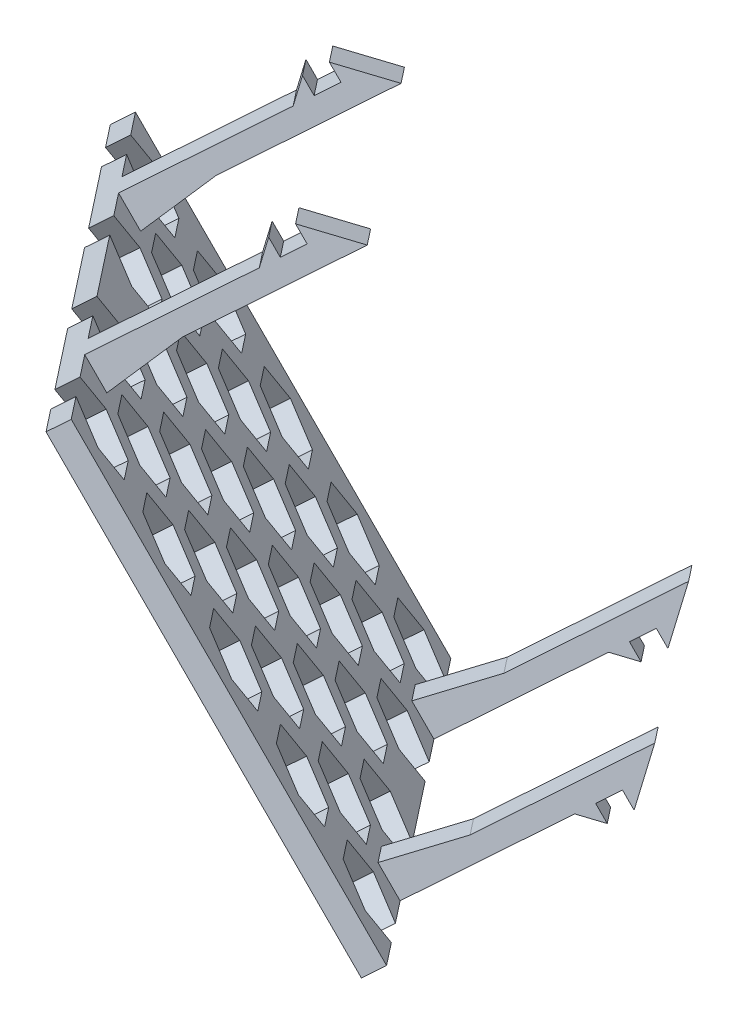
from build123d import *

# Parameters (mm, degrees)
EXTRUDE_1_DEPTH             = 3
EXTRUDE_2_DEPTH             = 5
CHAMFER_1_SIZE              = 10
CHAMFER_1_SIZE2             = 1.7632698070846542
CHAMFER_1_OF_MIRROR_1_SIZE2 = 1.7632698070846542
CHAMFER_1_OF_MIRROR_1_SIZE  = 10
MIRROR_START                = 100.557274191
MIRROR_2_DEPTH              = 5
MIRROR_START_2              = 150.557274191
MIRROR_2_2_DEPTH            = 5
CUT_EXTRUDE_START           = -3
CUT_EXTRUDE_1_DEPTH         = 3
EXTRUDE_3_DEPTH             = 5
MIRROR_4_COPY_1_DEPTH       = 5


# Read off the part's stored shape, not the designer's step: 镜向2, 切除-拉伸1
with BuildPart() as part:
    # 草图1 → 凸台-拉伸1 (new body)
    with BuildSketch(Plane(origin=(-302.9852871236554, -539.4308733926825, 499.4175609106197), x_dir=(0.823284870968576, -0.3326085977835135, 0.459971240312631), z_dir=(-0.5676284182757724, -0.4824135256318378, 0.6671395424146325))):
        Polygon((-177.69119627834579, 290.92528000789076), (-105.02181846396432, 352.1148340843072), (-61.22297975663468, 300.09885838559205), (-133.89235757101616, 238.90930430917564), align=None)
    extrude(amount=EXTRUDE_1_DEPTH)

    # 草图2 → 凸台-拉伸2 (add)
    with BuildSketch(Plane(origin=(66.47619270977926, 28.238015488062796, 76.97966237080274), x_dir=(-0.7767863592562881, 0.2168814389007045, 0.5912405547099429), z_dir=(-0.6297642035503137, -0.2675136858592245, -0.7292691381133932))):
        Polygon((645.8799483555844, -434.2199494311762), (624.3231352890325, -414.0815828039215), (626.0297765286305, -412.25473423895954), (618.2560989585985, -412.5191903547605), (643.8319788680668, -436.4121677091307), align=None)
    extrude_2 = extrude(amount=EXTRUDE_2_DEPTH)

    # 倒角1
    chamfer_1_edges = [part.edges().sort_by_distance(p)[0] for p in [
        (-433.51523138196615, -241.06448364626053, 604.1085165056885),
    ]]
    chamfer_1_side = [part.faces().sort_by_distance(p)[0] for p in [
        (-424.4331766895539, -233.34586723615118, 593.4342838270544),
    ]]
    chamfer(chamfer_1_edges, length=CHAMFER_1_SIZE, length2=CHAMFER_1_SIZE2, reference=chamfer_1_side[0])

    # 镜向1: 凸台-拉伸2 across plane
    add(extrude_2.mirror(Plane(origin=(80.64588728966129, 34.25707341989526, 93.388217978354), x_dir=(-0.6712211429872029, -0.2851239257088115, 0.6842269537188292), z_dir=(0.6297642035503136, 0.26751368585922486, 0.729269138113393))))

    # 倒角1 of 镜向1
    chamfer_1_of_mirror_1_edges = [part.edges().sort_by_distance(p)[0] for p in [
        (-402.0270212044504, -227.68879935329932, 640.571973411358),
    ]]
    chamfer(chamfer_1_of_mirror_1_edges, length=CHAMFER_1_OF_MIRROR_1_SIZE, length2=CHAMFER_1_OF_MIRROR_1_SIZE2)

    # 镜向2 outline → 镜向2 (add)
    with BuildSketch(Plane(origin=(0, 0, 0), x_dir=(0.7767863592562967, -0.21688143890071088, -0.5912405547099291), z_dir=(0.6297642035503029, 0.26751368585923996, 0.7292691381133969)).offset(MIRROR_START)):
        Polygon((-597.267088361, -481.862260911), (-577.902493572, -463.771863771), (-576.195852332, -465.598712336), (-575.931396217, -457.825034766), (-592.007663588, -472.843477674), (-600.518765436, -478.381551866), align=None)
    extrude(amount=MIRROR_2_DEPTH)

    # Mirror 2 2 outline → Mirror 2 2 (add)
    with BuildSketch(Plane(origin=(0, 0, 0), x_dir=(0.7767863592562967, -0.21688143890071088, -0.5912405547099291), z_dir=(0.6297642035503029, 0.26751368585923996, 0.7292691381133969)).offset(MIRROR_START_2)):
        Polygon((-597.267088361, -481.862260911), (-577.902493572, -463.771863771), (-576.195852332, -465.598712336), (-575.931396217, -457.825034766), (-592.007663588, -472.843477674), (-600.518765436, -478.381551866), align=None)
    extrude(amount=MIRROR_2_2_DEPTH)

    # 切除-拉伸1 outline → 切除-拉伸1 (cut)
    with BuildSketch(Plane(origin=(-436.1617099127484, -370.683181902277, 512.6253622992621), x_dir=(0.8232848709685762, -0.3326085977835133, 0.45997124031263076), z_dir=(-0.5676284182757722, -0.48241352563183804, 0.6671395424146325)).offset(CUT_EXTRUDE_START)):
        Polygon((-11.539182151, 145.08829532), (-5.897514961, 143.045847938), (-1.307870046, 146.910451353), (-2.359892322, 152.817502151), (-8.001559513, 154.859949534), (-12.591204427, 150.995346118), align=None)
        Polygon((49.265906307, 203.080682971), (44.676261393, 199.216079555), (45.728283669, 193.309028757), (51.369950859, 191.266581375), (55.959595774, 195.13118479), (54.907573498, 201.038235588), align=None)
        Polygon((30.176751034, 187.007105158), (25.587106119, 183.142501743), (26.639128395, 177.235450945), (32.280795586, 175.193003562), (36.870440501, 179.057606978), (35.818418225, 184.964657776), align=None)
        Polygon((11.087595761, 170.933527346), (6.497950846, 167.068923931), (7.549973122, 161.161873133), (13.191640313, 159.11942575), (17.781285227, 162.984029165), (16.729262951, 168.891079963), align=None)
        Polygon((82.735446524, 167.982016712), (77.093779334, 170.024464094), (72.504134419, 166.159860679), (73.556156695, 160.252809881), (79.197823885, 158.210362498), (83.7874688, 162.074965914), align=None)
        Polygon((19.833738654, 121.809982824), (15.244093739, 117.945379408), (16.296116015, 112.03832861), (21.937783206, 109.995881227), (26.52742812, 113.860484643), (25.475405844, 119.767535441), align=None)
        Polygon((63.647776992, 151.914209588), (58.006109802, 153.956656971), (53.416464887, 150.092053555), (54.468487163, 144.185002757), (60.110154354, 142.142555374), (64.699799268, 146.00715879), align=None)
        Polygon((38.916954529, 137.883079158), (34.327309614, 134.018475743), (35.37933189, 128.111424945), (41.020999081, 126.068977562), (45.610643995, 129.933580978), (44.558621719, 135.840631776), align=None)
        Polygon((31.428171122, 127.404806736), (30.376148846, 133.311857535), (24.734481655, 135.354304917), (20.144836741, 131.489701502), (21.196859017, 125.582650704), (26.838526207, 123.540203321), align=None)
        Polygon((45.927681481, 139.613781133), (50.517326395, 143.478384549), (49.465304119, 149.385435347), (43.823636929, 151.42788273), (39.233992014, 147.563279314), (40.28601429, 141.656228516), align=None)
        Polygon((59.375169563, 157.729806328), (65.016836754, 155.687358946), (69.606481669, 159.551962361), (68.554459393, 165.459013159), (62.912792202, 167.501460542), (58.323147288, 163.636857126), align=None)
        Polygon((63.222393818, 177.177416296), (64.274416094, 171.270365498), (69.916083285, 169.227918116), (74.505728199, 173.092521531), (73.453705924, 178.999572329), (67.812038733, 181.042019712), align=None)
        Polygon((16.199124493, 130.789687892), (10.557457303, 132.832135275), (5.967812388, 128.967531859), (7.019834664, 123.060481061), (12.661501855, 121.018033679), (17.251146769, 124.882637094), align=None)
        Polygon((35.281837572, 146.857841204), (29.640170381, 148.900288587), (25.050525467, 145.035685172), (26.102547743, 139.128634374), (31.744214933, 137.086186991), (36.333859848, 140.950790406), align=None)
        Polygon((48.729325654, 164.973866399), (44.13968074, 161.109262984), (45.191703016, 155.202212186), (50.833370206, 153.159764803), (55.423015121, 157.024368219), (54.370992845, 162.931419017), align=None)
        Polygon((92.012722739, 156.97175807), (86.371055548, 159.014205453), (81.781410634, 155.149602037), (82.83343291, 149.242551239), (88.4751001, 147.200103857), (93.064745015, 151.064707272), align=None)
        Polygon((31.20763428, 98.97937042), (35.797279195, 102.843973835), (34.745256919, 108.751024633), (29.103589728, 110.793472016), (24.513944814, 106.9288686), (25.56596709, 101.021817802), align=None)
        Polygon((50.296789553, 115.052948232), (54.886434468, 118.917551647), (53.834412192, 124.824602445), (48.192745002, 126.867049828), (43.603100087, 123.002446413), (44.655122363, 117.095395615), align=None)
        Polygon((69.385944827, 131.126526044), (73.975589741, 134.99112946), (72.923567465, 140.898180258), (67.281900275, 142.94062764), (62.69225536, 139.076024225), (63.744277636, 133.168973427), align=None)
        Polygon((40.703961595, 116.388777406), (39.651939319, 122.295828204), (34.010272128, 124.338275587), (29.420627214, 120.473672172), (30.47264949, 114.566621374), (36.11431668, 112.524173991), align=None)
        Polygon((55.203471954, 128.597751803), (59.793116868, 132.462355219), (58.741094592, 138.369406017), (53.099427402, 140.411853399), (48.509782487, 136.547249984), (49.561804763, 130.640199186), align=None)
        Polygon((68.650960036, 146.713776998), (74.292627227, 144.671329616), (78.882272142, 148.535933031), (77.830249866, 154.442983829), (72.188582675, 156.485431212), (67.59893776, 152.620827796), align=None)
        Polygon((30.911735824, 171.419854204), (25.270068634, 173.462301587), (20.680423719, 169.597698172), (21.732445995, 163.690647374), (27.374113186, 161.648199991), (31.9637581, 165.512803406), align=None)
        Polygon((11.822580551, 155.346276392), (6.180913361, 157.388723775), (1.591268446, 153.524120359), (2.643290722, 147.617069561), (8.284957912, 145.574622179), (12.874602827, 149.439225594), align=None)
        Polygon((44.359223907, 189.535879399), (39.769578993, 185.671275984), (40.821601269, 179.764225186), (46.463268459, 177.721777803), (51.052913374, 181.586381219), (50.000891098, 187.493432017), align=None)
        Polygon((-2.261905937, 134.078036679), (3.379761254, 132.035589296), (7.969406169, 135.900192711), (6.917383893, 141.807243509), (1.275716702, 143.849690892), (-3.313928212, 139.985087477), align=None)
        Polygon((60.639801934, 180.250070567), (65.229446848, 184.114673982), (64.177424572, 190.02172478), (58.535757382, 192.064172163), (53.946112467, 188.199568748), (54.998134743, 182.29251795), align=None)
        Polygon((16.825763595, 150.145843802), (22.467430786, 148.10339642), (27.0570757, 151.967999835), (26.005053424, 157.875050633), (20.363386234, 159.917498016), (15.773741319, 156.052894601), align=None)
        Polygon((41.556586059, 164.176974232), (46.146230974, 168.041577647), (45.094208698, 173.948628445), (39.452541507, 175.991075828), (34.862896592, 172.126472413), (35.914918868, 166.219421615), align=None)
        Polygon((11.919081195, 136.601040231), (17.560748385, 134.558592849), (22.1503933, 138.423196264), (21.098371024, 144.330247062), (15.456703834, 146.372694445), (10.867058919, 142.508091029), align=None)
        Polygon((55.739058932, 166.705748473), (60.328703847, 170.570351888), (59.276681571, 176.477402687), (53.63501438, 178.519850069), (49.045369466, 174.655246654), (50.097391742, 168.748195856), align=None)
        Polygon((31.008236468, 152.674618044), (36.649903659, 150.632170661), (41.239548573, 154.496774076), (40.187526297, 160.403824874), (34.545859107, 162.446272257), (29.956214192, 158.581668842), align=None)
    extrude(amount=CUT_EXTRUDE_1_DEPTH, mode=Mode.SUBTRACT)

    # 草图4 → 凸台-拉伸3 (add)
    with BuildSketch(Plane(origin=(63.327371692027775, 26.90044705876477, 73.33331668023462), x_dir=(-0.7767863592562869, 0.216881438900701, 0.5912405547099456), z_dir=(-0.6297642035503151, -0.2675136858592191, -0.729269138113394))):
        Polygon((626.6615014521869, -416.2660835906029), (628.3681426917847, -414.43923502564076), (628.4883500171486, -417.97272483020055), align=None)
    extrude_3 = extrude(amount=-EXTRUDE_3_DEPTH)

    # 镜向3: 凸台-拉伸3 across plane
    add(extrude_3.mirror(Plane(origin=(80.64588728966129, 34.25707341989526, 93.388217978354), x_dir=(-0.6712211429872029, -0.2851239257088115, 0.6842269537188292), z_dir=(0.6297642035503136, 0.26751368585922486, 0.729269138113393))))

    # 镜向4: 凸台-拉伸3 across plane
    add(extrude_3.mirror(Plane(origin=(-47.51956305015683, 74.74529721724666, 13.617372927370248), x_dir=(0.08152701690098424, -0.12823689273126515, 0.9883868902701293), z_dir=(-0.5302782540255494, 0.8340944899503124, 0.1519583993800388))))

    # 镜向4 copy 1 sketch → 镜向4 copy 1 (add)
    with BuildSketch(Plane(origin=(2.925276786980831, 191.10429421551913, 140.677865131214), x_dir=(-0.05279056983072454, -0.9219186045157413, 0.3837697778417371), z_dir=(0.6297642035503169, 0.2675136858592234, 0.7292691381133908))):
        Polygon((626.6615014521869, -416.2660835906029), (628.3681426917847, -414.43923502564076), (628.4883500171486, -417.97272483020055), align=None)
    extrude(amount=-MIRROR_4_COPY_1_DEPTH)


solid = part.part
